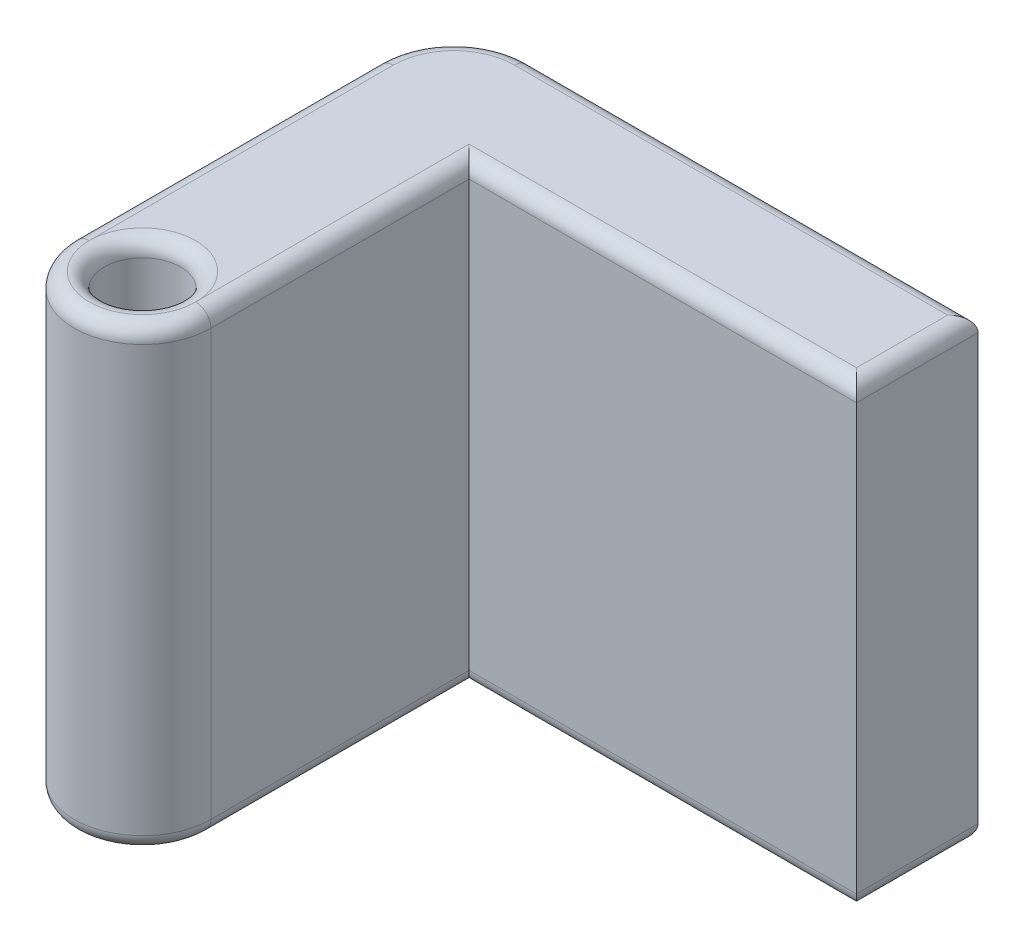
from build123d import *

# Parameters (mm, degrees)
SKETCH1_R           = 2.5
BOSS_EXTRUDE1_DEPTH = 30
FILLET1_R           = 1
FILLET2_R           = 5


# Some blends are built 0.0001 mm under size
with BuildPart() as part:
    # Sketch1 → Boss-Extrude1 (new body)
    with BuildSketch(Plane(origin=(0, 0, 0), x_dir=(1, 0, 0), z_dir=(0, 1, 0))):
        with BuildLine():
            Line((0, 0), (-34.5, 0))
            Line((-34.5, 0), (-34.5, -25))
            ThreePointArc((-34.5, -25), (-30, -29.5), (-25.5, -25))
            Line((-25.5, -25), (-25.5, -8))
            Line((-25.5, -8), (0, -8))
            Line((0, -8), (0, 0))
        make_face()
        with Locations(Location((-30, -25, 0), (0, 0, 270))):
            Circle(SKETCH1_R, mode=Mode.SUBTRACT)
    extrude(amount=BOSS_EXTRUDE1_DEPTH)

    # Fillet1
    fillet1_edges = [part.edges().sort_by_distance(p)[0] for p in [
        (-34.5, 30, 12.5),
        (-30, 30, 29.5),
        (-30, 0, 22.5),
        (-30, 30, 22.5),
        (-25.5, 30, 16.5),
        (-12.75, 30, 8),
        (0, 30, 4),
        (-12.75, 0, 8),
        (-25.5, 0, 16.5),
        (-30, 0, 29.5),
        (-34.5, 0, 12.5),
        (-17.25, 0, 0),
        (0, 0, 4),
        (-17.25, 30, 0),
    ]]
    fillet(fillet1_edges, radius=FILLET1_R - 0.0001)  # a hair under: the kernel refuses the full size

    # Fillet2
    # the kernel refuses this fillet: 5 mm, written as the material it takes off along each edge
    with BuildSketch(Plane(origin=(-29.5, 0, 5), x_dir=(-1, 0, 0), z_dir=(0, 0, 1))) as fillet2_piece_1:
        with BuildLine():
            CenterArc((4.0001, -0.9999), 0.9999, 0, 90)
            Line((5, -0.9999), (5, 0))
            Line((5, 0), (4.0001, 0))
        make_face()
    revolve(axis=Axis((-29.5, 0, 5), (0, -1, 0)), revolution_arc=90, mode=Mode.SUBTRACT)
    with BuildSketch(Plane(origin=(-29.5, 30, 5), x_dir=(0, 0, -1), z_dir=(1, 0, 0))) as fillet2_piece_2:
        with BuildLine():
            CenterArc((4.0001, -0.9999), 0.9999, 0, 90)
            Line((5, -0.9999), (5, 0))
            Line((5, 0), (4.0001, 0))
        make_face()
    revolve(axis=Axis((-29.5, 30, 5), (0, 1, 0)), revolution_arc=90, mode=Mode.SUBTRACT)
    with BuildSketch(Plane(origin=(-34.5, 0, 0), x_dir=(1, 0, 0), z_dir=(0, 1, 0))) as fillet2_piece_3:
        with BuildLine():
            CenterArc((FILLET2_R, -FILLET2_R), FILLET2_R, 90, 90)
            Line((0, -FILLET2_R), (0, 0))
            Line((0, 0), (FILLET2_R, 0))
        make_face()
    extrude(amount=30, mode=Mode.SUBTRACT)


solid = part.part
